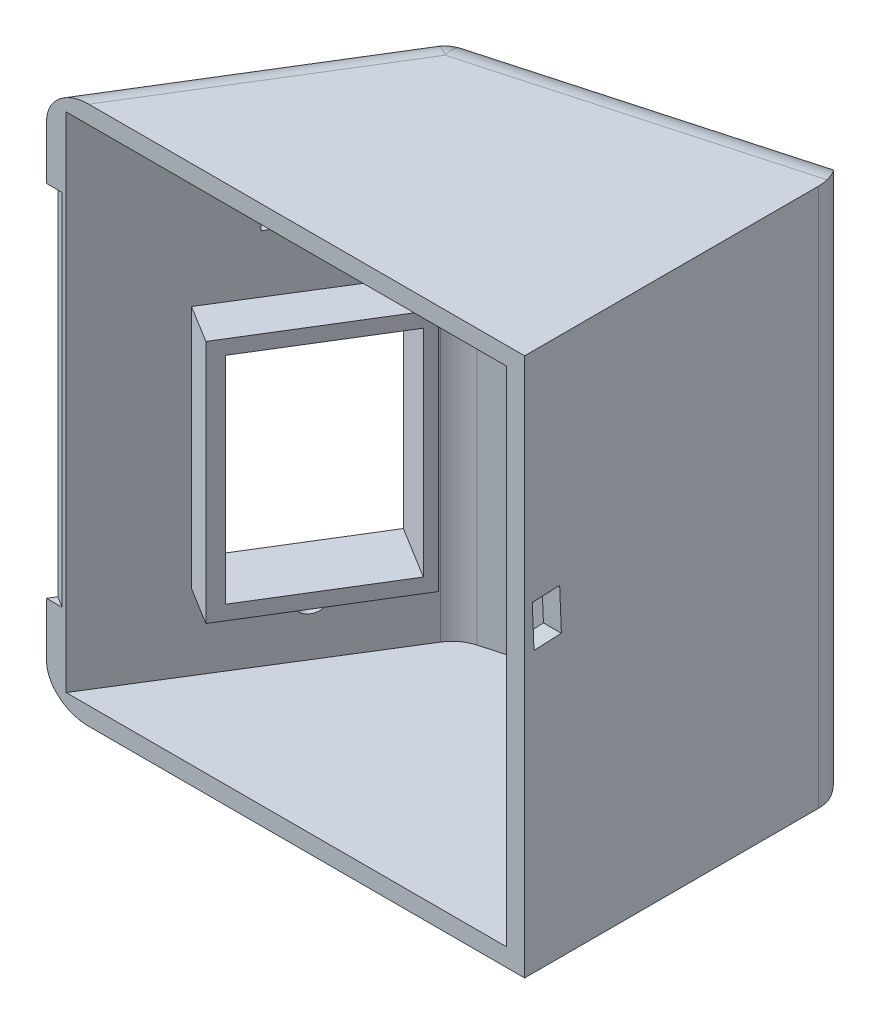
from build123d import *

# Parameters (mm, degrees)
ESBO_O1_W                  = 170
ESBO_O1_H                  = 30
RESSALTO_EXTRUS_O1_DEPTH   = 150
CORTE_EXTRUS_O1_DEPTH      = 222
CORTE_EXTRUS_O1_DEPTH_BACK = 36
RESSALTO_EXTRUS_O2_DEPTH   = 5
RESSALTO_EXTRUS_O3_DEPTH   = 5
ESBO_O4_W                  = 159.333333333
ESBO_O4_H                  = 140.588235294
CORTE_EXTRUS_O2_DEPTH      = 25
CORTE_EXTRUS_O3_DEPTH      = 31
CORTE_EXTRUS_O4_DEPTH      = 42
FILETE1_R                  = 10
CORTE_EXTRUS_O5_DEPTH      = 32
CORTE_EXTRUS_O6_START      = -15.72292277
CORTE_EXTRUS_O6_OUTLINE_R  = 3.95
CORTE_EXTRUS_O6_DEPTH      = 4.876648775
CORTE_EXTRUS_O7_START      = -132.751356438
CORTE_EXTRUS_O7_OUTLINE_R  = 3.95
CORTE_EXTRUS_O7_DEPTH      = 3.479370229
RESSALTO_EXTRUS_O6_DEPTH   = 17
RESSALTO_EXTRUS_O7_DEPTH   = 4
CORTE_EXTRUS_O8_DEPTH      = 21
F_3DSKETCH12_R             = 1.5
CORTE_EXTRUS_O9_DEPTH      = 14
CORTE_EXTRUS_O10_DEPTH     = 19
ESBO_O11_W                 = 17.407525744
ESBO_O11_H                 = 16.792397695
CORTE_EXTRUS_O11_DEPTH     = 10
CORTE_EXTRUS_O12_DEPTH     = 20
CORTE_EXTRUS_O13_DEPTH     = 14
ESBO_O12_W                 = 182.438351364
ESBO_O12_H                 = 161.616583002
CORTE_EXTRUS_O14_DEPTH     = 90


# Read off the part's stored shape, not the designer's step: Corte-extrusão6, Corte-extrusão7
with BuildPart() as part:
    # Esboço1 → Ressalto-extrusão1 (new body)
    with BuildSketch(Plane(origin=(0, 0, 0), x_dir=(1, 0, 0), z_dir=(0, 1, 0))):
        with Locations((85, 15)):
            Rectangle(ESBO_O1_W, ESBO_O1_H)
        Polygon((80, 160), (0, 30), (170, 30), (170, 160), align=None)
        Polygon((170, 160), (170, 185), (80, 160), align=None)
    extrude(amount=RESSALTO_EXTRUS_O1_DEPTH)

    # Esboço2 → Corte-extrusão1 (cut, two sides: drawn at the far end of the back side and taken through both)
    with BuildSketch(Plane(origin=(0, 0, 0), x_dir=(1, 0, 0), z_dir=(0, 1, 0)).offset(-CORTE_EXTRUS_O1_DEPTH_BACK)):
        Polygon((84.391050739, 157.608625205), (165, 180), (165, 5), (5, 5), (5, 29.866892941), align=None)
    extrude(amount=CORTE_EXTRUS_O1_DEPTH + CORTE_EXTRUS_O1_DEPTH_BACK, mode=Mode.SUBTRACT)

    # Esboço3 → Ressalto-extrusão2 (add)
    with BuildSketch(Plane(origin=(0, 0, 0), x_dir=(1, 0, 0), z_dir=(0, 1, 0))):
        Polygon((84.391050739, 157.608625205), (165, 180), (165, 5), (5, 5), (5, 29.866892941), align=None)
    extrude(amount=RESSALTO_EXTRUS_O2_DEPTH)

    # 3DSketch2 → Ressalto-extrusão3 (add)
    with BuildSketch(Plane(origin=(165, 150, -5), x_dir=(0, 0, -1), z_dir=(0, 1, 0))):
        Polygon((0, 0), (0, 160), (24.866892941, 160), (152.608625205, 80.608949261), (175, 0), align=None)
    extrude(amount=-RESSALTO_EXTRUS_O3_DEPTH)

    # Esboço4 → Corte-extrusão2 (cut)
    with BuildSketch(Plane.XY):
        with Locations((85.333333333, 74.705882353)):
            Rectangle(ESBO_O4_W, ESBO_O4_H)
    extrude(amount=-CORTE_EXTRUS_O2_DEPTH, mode=Mode.SUBTRACT)

    # 3DSketch3 → Corte-extrusão3 (cut)
    with BuildSketch(Plane(origin=(74.759025743, 90, -151.483416833), x_dir=(-0.29071694485714406, -0.8320502943378435, 0.4724150353928592), z_dir=(-0.8516583167045438, 0, -0.5240974256643346))):
        Polygon((0, 0), (22.188007849, 33.282011774), (72.111025509, 0), (49.92301766, -33.282011774), align=None)
    extrude(amount=-CORTE_EXTRUS_O3_DEPTH, mode=Mode.SUBTRACT)

    # 3DSketch4 → Corte-extrusão4 (cut)
    with BuildSketch(Plane(origin=(69.518051487, 130, -142.966833666), x_dir=(-0.37059284368967266, -0.7071067811865471, 0.6022133709956982), z_dir=(0.8516583167045362, 0, 0.5240974256643472))):
        Polygon((0, 0), (14.142135624, -14.142135624), (28.284271247, 0), (14.142135624, 14.142135624), align=None)
    extrude(amount=CORTE_EXTRUS_O4_DEPTH, mode=Mode.SUBTRACT)

    # Filete1
    filete1_edges = [part.edges().sort_by_distance(p)[0] for p in [
        (170, 75, -185),
        (125, 0, -172.5),
        (125, 150, -172.5),
        (80, 75, -160),
        (40, 0, -95),
        (40, 150, -95),
        (0, 75, -30),
        (84.391050739, 75, -157.608625205),
    ]]
    fillet(filete1_edges, radius=FILETE1_R)

    # 3DSketch5 → Corte-extrusão5 (cut)
    with BuildSketch(Plane(origin=(38.121221288, 25, -91.946984593), x_dir=(-0.194644897392922, 0.9284766908852593, 0.31629795826349816), z_dir=(0.851658316704544, 0, 0.5240974256643347))):
        Polygon((0, 0), (14.855627054, 37.139067635), (107.703296143, 0), (92.847669089, -37.139067635), align=None)
    extrude(amount=CORTE_EXTRUS_O5_DEPTH, mode=Mode.SUBTRACT)

    # Corte-extrusão6 outline → Corte-extrusão6 (cut)
    with BuildSketch(Plane(origin=(0, 0, 0), x_dir=(0.5240974256643349, 0, -0.8516583167045437), z_dir=(0.8516583167045437, 0, 0.5240974256643349)).offset(CORTE_EXTRUS_O6_START)):
        with Locations((148.193124726, 20)):
            Circle(CORTE_EXTRUS_O6_OUTLINE_R)
    extrude(amount=CORTE_EXTRUS_O6_DEPTH, mode=Mode.SUBTRACT)

    # Corte-extrusão7 outline → Corte-extrusão7 (cut)
    with BuildSketch(Plane(origin=(0, 0, 0), x_dir=(0.9635179096299408, 0, -0.267643863786094), z_dir=(0.267643863786094, 0, 0.9635179096299409)).offset(CORTE_EXTRUS_O7_START)):
        with Locations((161.993020775, 122.164347625)):
            Circle(CORTE_EXTRUS_O7_OUTLINE_R)
    extrude(amount=CORTE_EXTRUS_O7_DEPTH, mode=Mode.SUBTRACT)

    # 3DSketch9 → Ressalto-extrusão6 (add)
    with BuildSketch(Plane(origin=(76.350750718, 26, -154.069969916), x_dir=(-0.29815073011621673, 0.8224176546598938, 0.4844949364388514), z_dir=(0.8516583167045438, 0, 0.5240974256643349))):
        Polygon((0, 0), (26.758649409, 38.684123705), (82.683049926, 0), (55.924400517, -38.684123705), align=None)
        Polygon((5.017416454, 0.222210211), (27.772783339, 33.118916398), (77.117842619, -1.01413393), (54.362475733, -33.910840117), align=None, mode=Mode.SUBTRACT)
    extrude(amount=RESSALTO_EXTRUS_O6_DEPTH)

    # 3DSketch10 → Ressalto-extrusão7 (add, along a direction that is not the sketch's normal)
    with BuildSketch(Plane(origin=(0, 0, 0), x_dir=(0.7498378553650926, 0.6616216370868463, 0), z_dir=(0, 0, 1))):
        with BuildLine():
            Line((0, 0), (14.996757107, -13.232432742))
            Line((14.996757107, -13.232432742), (28.229189849, 1.764324366))
            ThreePointArc((28.229189849, 1.764324366), (21.556867541, 14.536675999), (25.141622209, 28.493838504))
            Line((25.141622209, 28.493838504), (13.232432742, 14.996757107))
            Line((13.232432742, 14.996757107), (0, 0))
        make_face()
        with BuildLine():
            Line((99.243245563, 112.475678305), (115.742930564, 97.917132715))
            Line((115.742930564, 97.917132715), (100.070543679, 80.155094246))
            ThreePointArc((100.070543679, 80.155094246), (86.055529464, 85.755516688), (71.66166921, 81.216558438))
            Line((71.66166921, 81.216558438), (83.570858678, 94.713639835))
            Line((83.570858678, 94.713639835), (99.243245563, 112.475678305))
        make_face()
        Polygon((226.715680975, 0), (211.718923868, 13.232432742), (198.486491126, -1.764324366), (213.483248233, -14.996757107), align=None)
        Polygon((127.472435412, -112.475678305), (112.475678305, -99.243245563), (125.708111047, -84.246488456), (140.704868154, -97.478921197), align=None)
    extrude(amount=-RESSALTO_EXTRUS_O7_DEPTH, dir=(0.26764386378609445, 0, 0.9635179096299407))

    # 3DSketch11 → Corte-extrusão8 (cut)
    with BuildSketch(Plane(origin=(153.100052242, 17.26943239, -180.305570067), x_dir=(-0.07376023038027929, 0.9970655099962036, 0.02048895288341091), z_dir=(0.2676438637860946, 0, 0.9635179096299407))):
        Polygon((0, 0), (0.269964353, 3.516152018), (46.066103253, 0), (45.7961389, -3.516152018), align=None)
    extrude(amount=CORTE_EXTRUS_O8_DEPTH, mode=Mode.SUBTRACT)

    # 3DSketch12 → Corte-extrusão9 (cut)
    with BuildSketch(Plane(origin=(160, 140, 0), x_dir=(-0.7560654573770964, -0.6544960077503622, 0), z_dir=(0, 0, 1))):
        with Locations(Location((0, 0, 0), (0, 0, 319.118554366))):
            Circle(F_3DSKETCH12_R)
        with Locations(Location((85.084481008, 98.288509459, 0), (0, 0, 319.118554366))):
            Circle(F_3DSKETCH12_R)
        with Locations(Location((113.858951537, -96.124361942, 0), (0, 0, 139.118554366))):
            Circle(F_3DSKETCH12_R)
        with Locations(Location((196.909602971, 0, 0), (0, 0, 139.118554366))):
            Circle(F_3DSKETCH12_R)
    extrude(amount=-CORTE_EXTRUS_O9_DEPTH, mode=Mode.SUBTRACT)

    # 3DSketch13 → Corte-extrusão10 (cut)
    with BuildSketch(Plane(origin=(170, 70.245878967, 0), x_dir=(0, -0.4354246522459521, -0.9002251786172678), z_dir=(-1, 0, 0))):
        Polygon((0, 0), (32.261446294, -15.604350297), (39.809023237, 0), (7.547576943, 15.604350297), align=None)
    extrude(amount=CORTE_EXTRUS_O10_DEPTH, mode=Mode.SUBTRACT)

    # Esboço11 → Corte-extrusão11 (cut)
    with BuildSketch(Plane(origin=(170, 0, 0), x_dir=(0, 0, -1), z_dir=(1, 0, 0))):
        with Locations((8.703762872, 30.096304842)):
            Rectangle(ESBO_O11_W, ESBO_O11_H)
    extrude(amount=-CORTE_EXTRUS_O11_DEPTH, mode=Mode.SUBTRACT)

    # 3DSketch14 → Corte-extrusão12 (cut)
    with BuildSketch(Plane(origin=(170, 87.396079578, 0), x_dir=(0, -0.09341146144778735, -0.9956275904524686), z_dir=(1, 0, 0))):
        Polygon((0, 0), (20.627912038, 1.935345533), (19.506160301, 13.891554783), (-1.121751737, 11.956209249), align=None)
        Polygon((-2.576084268, 27.457236328), (18.165947056, 29.403288726), (16.691971594, 45.113680317), (-4.050059731, 43.167627919), align=None)
        Polygon((91.534016736, 10.656116635), (99.096194716, 11.679615344), (100.676965661, 0), (93.114787682, -1.02349871), align=None)
    extrude(amount=-CORTE_EXTRUS_O12_DEPTH, mode=Mode.SUBTRACT)

    # 3DSketch15 → Corte-extrusão13 (cut)
    with BuildSketch(Plane(origin=(129.748977416, 150, 0), x_dir=(-0.6170578351280018, 0, -0.7869178026370631), z_dir=(0, -1, 0))):
        Polygon((0, 0), (11.819817446, 9.268453377), (19.087630878, 0), (7.267813432, -9.268453377), align=None)
    extrude(amount=CORTE_EXTRUS_O13_DEPTH, mode=Mode.SUBTRACT)

    # Esboço12 → Corte-extrusão14 (cut)
    with BuildSketch(Plane.XY):
        with Locations((84.195107922, 72.896320561)):
            Rectangle(ESBO_O12_W, ESBO_O12_H)
    extrude(amount=-CORTE_EXTRUS_O14_DEPTH, mode=Mode.SUBTRACT)


solid = part.part
